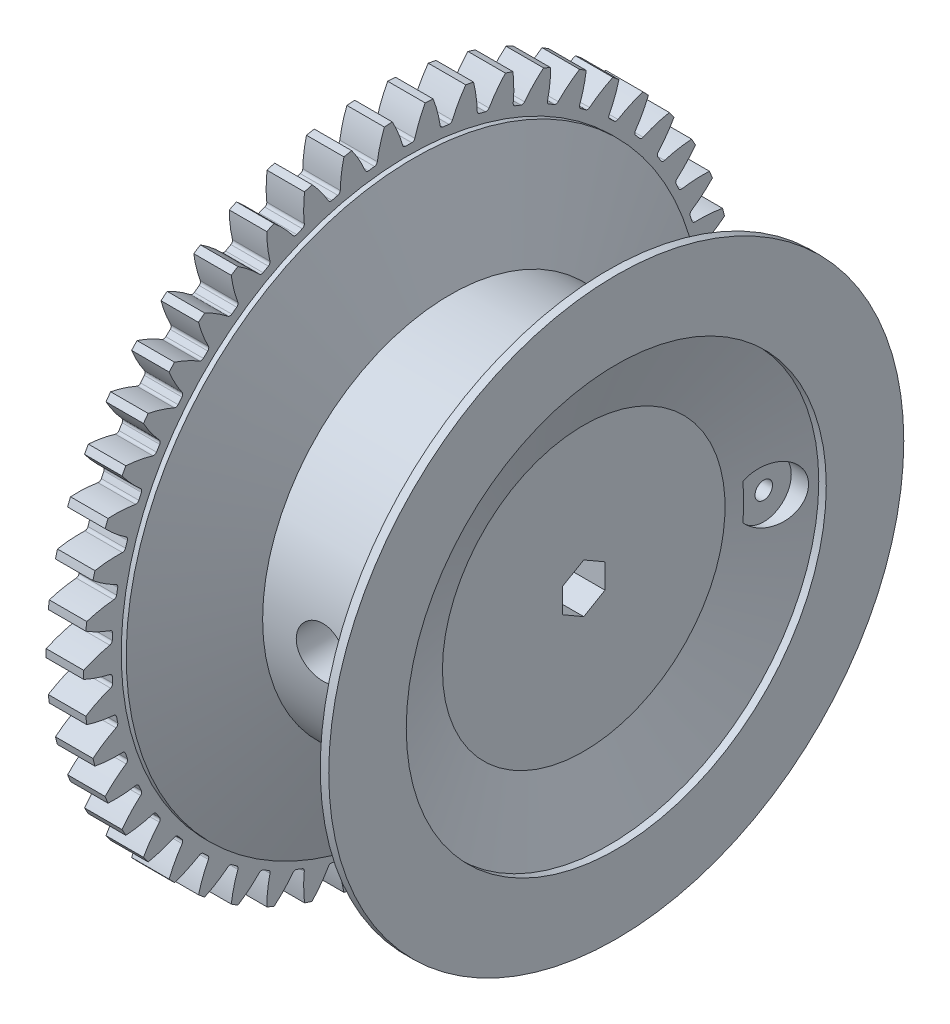
from build123d import *

# Parameters (mm, degrees)
BASPROSKE_W                = 1.5
BASPROSKE_H                = 13
TOOTHCUT_DEPTH             = 19.445866746
ROOTFILLETS_R              = 0.126
TEETHCUTS_COUNT            = 50
TEETHCUTS_ANGLE            = 352.8
ROOTFILLETS_OF_TEETHCUTS_R = 0.126
SHAFTHOLE_DEPTH            = 21.683738738
SHAFTHOLE_DEPTH_BACK       = 21.683738738
PADSKE_R                   = 2
PAD_DEPTH                  = 1.5
SCREWHOLE_DEPTH            = 21.683738784
SCREWHOLE_DEPTH_BACK       = 21.683738784
SCREWHOLESKE_R             = 0.35
PAD2SKE_R                  = 1.1
PAD2_DEPTH                 = 0.8
BOLD_ANGLE                 = 330
SCREWHOLE2SKE_R            = 1
SCREWHOLE2_DEPTH           = 21.683738784
WIDENSKE_W                 = 0.3
WIDENSKE_H                 = 3.100131381
CHAMFER_2_SIZE             = 0.8
CHAMFER_2_SIZE2            = 0.160409315


with BuildPart() as part:
    # BasProSke → Base-Revolve (revolve)
    with BuildSketch(Plane(origin=(0, 0, 0), x_dir=(1, 0, 0), z_dir=(0, 1, 0))):
        with Locations((0.75, 6.5)):
            Rectangle(BASPROSKE_W, BASPROSKE_H)
    revolve(axis=Axis((-10, 0, 0), (1, 0, 0)))

    # TooCutSke → ToothCut (cut, through all)
    with BuildSketch(Plane(origin=(0, 0, 0), x_dir=(0, 0, -1), z_dir=(1, 0, 0))):
        with BuildLine():
            ThreePointArc((0.218701072, 11.871985758), (0, 11.874), (-0.218701072, 11.871985758))
            ThreePointArc((-0.218701072, 11.871985758), (-0.410224227, 12.453928998), (-0.671481128, 13.008080498))
            ThreePointArc((-0.671481128, 13.008080498), (0, 13.0254), (0.671481128, 13.008080498))
            ThreePointArc((0.671481128, 13.008080498), (0.410224227, 12.453928998), (0.218701072, 11.871985758))
        make_face()
    toothcut = extrude(amount=TOOTHCUT_DEPTH, mode=Mode.SUBTRACT)

    # RootFillets
    rootfillets_edges = [part.edges().sort_by_distance(p)[0] for p in [
        (0.75, 11.871985758, -0.218701072),
        (0.75, 11.871985758, 0.218701072),
    ]]
    fillet(rootfillets_edges, radius=ROOTFILLETS_R)

    # TeethCuts: ToothCut ×50 about axis
    teethcuts_axis = Axis((-10, 0, 0), (1, 0, 0))
    for i in range(1, TEETHCUTS_COUNT):
        add(toothcut.rotate(teethcuts_axis, i * TEETHCUTS_ANGLE / (TEETHCUTS_COUNT - 1)), mode=Mode.SUBTRACT)

    # RootFillets of TeethCuts
    rootfillets_of_teethcuts_edges = [part.edges().sort_by_distance(p)[0] for p in [
        (0.75, 11.805782117, 1.270977815),
        (0.75, 11.750961092, 1.704930912),
        (0.75, 11.553394239, 2.740612623),
        (0.75, 11.44461675, 3.164272974),
        (0.75, 11.118802433, 4.167026333),
        (0.75, 10.957783965, 4.573712561),
        (0.75, 10.50886047, 5.527723548),
        (0.75, 10.29814038, 5.911021968),
        (0.75, 9.7331875, 6.80124526),
        (0.75, 9.476088971, 7.155111028),
        (0.75, 8.804016349, 7.967507272),
        (0.75, 8.504593977, 8.286359712),
        (0.75, 7.7360006, 9.008116935),
        (0.75, 7.398976456, 9.286927554),
        (0.75, 6.545983501, 9.906663212),
        (0.75, 6.176672657, 10.141035001),
        (0.75, 5.252732332, 10.648975493),
        (0.75, 4.856959039, 10.835212268),
        (0.75, 3.876642436, 11.223347069),
        (0.75, 3.460648277, 11.358511764),
        (0.75, 2.439415573, 11.620719757),
        (0.75, 2.009761024, 11.702680745),
        (0.75, 0.963717669, 11.834826752),
        (0.75, 0.527178638, 11.86229146),
        (0.75, -0.527178638, 11.86229146),
        (0.75, -0.963717669, 11.834826752),
        (0.75, -2.009761024, 11.702680745),
        (0.75, -2.439415573, 11.620719757),
        (0.75, -3.460648277, 11.358511764),
        (0.75, -3.876642436, 11.223347069),
        (0.75, -4.856959039, 10.835212268),
        (0.75, -5.252732332, 10.648975493),
        (0.75, -6.176672657, 10.141035001),
        (0.75, -6.545983501, 9.906663212),
        (0.75, -7.398976456, 9.286927554),
        (0.75, -7.7360006, 9.008116935),
        (0.75, -8.504593977, 8.286359712),
        (0.75, -8.804016349, 7.967507272),
        (0.75, -9.476088971, 7.155111028),
        (0.75, -9.7331875, 6.80124526),
        (0.75, -10.29814038, 5.911021968),
        (0.75, -10.50886047, 5.527723548),
        (0.75, -10.957783965, 4.573712561),
        (0.75, -11.118802433, 4.167026333),
        (0.75, -11.44461675, 3.164272974),
        (0.75, -11.553394239, 2.740612623),
        (0.75, -11.750961092, 1.704930912),
        (0.75, -11.805782117, 1.270977815),
        (0.75, -11.871985758, 0.218701072),
        (0.75, -11.871985758, -0.218701072),
        (0.75, -11.805782117, -1.270977815),
        (0.75, -11.750961092, -1.704930912),
        (0.75, -11.553394239, -2.740612623),
        (0.75, -11.44461675, -3.164272974),
        (0.75, -11.118802433, -4.167026333),
        (0.75, -10.957783965, -4.573712561),
        (0.75, -10.50886047, -5.527723548),
        (0.75, -10.29814038, -5.911021968),
        (0.75, -9.7331875, -6.80124526),
        (0.75, -9.476088971, -7.155111028),
        (0.75, -8.804016349, -7.967507272),
        (0.75, -8.504593977, -8.286359712),
        (0.75, -7.7360006, -9.008116935),
        (0.75, -7.398976456, -9.286927554),
        (0.75, -6.545983501, -9.906663212),
        (0.75, -6.176672657, -10.141035001),
        (0.75, -5.252732332, -10.648975493),
        (0.75, -4.856959039, -10.835212268),
        (0.75, -3.876642436, -11.223347069),
        (0.75, -3.460648277, -11.358511764),
        (0.75, -2.439415573, -11.620719757),
        (0.75, -2.009761024, -11.702680745),
        (0.75, -0.963717669, -11.834826752),
        (0.75, -0.527178638, -11.86229146),
        (0.75, 0.527178638, -11.86229146),
        (0.75, 0.963717669, -11.834826752),
        (0.75, 2.009761024, -11.702680745),
        (0.75, 2.439415573, -11.620719757),
        (0.75, 3.460648277, -11.358511764),
        (0.75, 3.876642436, -11.223347069),
        (0.75, 4.856959039, -10.835212268),
        (0.75, 5.252732332, -10.648975493),
        (0.75, 6.176672657, -10.141035001),
        (0.75, 6.545983501, -9.906663212),
        (0.75, 7.398976456, -9.286927554),
        (0.75, 7.7360006, -9.008116935),
        (0.75, 8.504593977, -8.286359712),
        (0.75, 8.804016349, -7.967507272),
        (0.75, 9.476088971, -7.155111028),
        (0.75, 9.7331875, -6.80124526),
        (0.75, 10.29814038, -5.911021968),
        (0.75, 10.50886047, -5.527723548),
        (0.75, 10.957783965, -4.573712561),
        (0.75, 11.118802433, -4.167026333),
        (0.75, 11.44461675, -3.164272974),
        (0.75, 11.553394239, -2.740612623),
        (0.75, 11.750961092, -1.704930912),
        (0.75, 11.805782117, -1.270977815),
    ]]
    fillet(rootfillets_of_teethcuts_edges, radius=ROOTFILLETS_OF_TEETHCUTS_R)

    # ReelSke → Reel (revolve)
    with BuildSketch(Plane(origin=(0, 0, 0), x_dir=(1, 0, 0), z_dir=(0, 1, 0))):
        Polygon((1.5, 11.5), (1.7, 11.5), (3.701836288, 6), (7.298163712, 6), (9.3, 11.5), (9.5, 11.5), (9.5, 0), (1.5, 0), align=None)
    revolve(axis=Axis((9.5, 0, 0), (-1, 0, 0)))

    # ShaftHoleSke → ShaftHole (cut, two sides: drawn at the far end of the back side and taken through both)
    with BuildSketch(Plane.ZY.offset(-SHAFTHOLE_DEPTH_BACK)):
        Polygon((0.85, 0.490747729), (0, 0.981495458), (-0.85, 0.490747729), (-0.85, -0.490747729), (0, -0.981495458), (0.85, -0.490747729), align=None)
    extrude(amount=SHAFTHOLE_DEPTH + SHAFTHOLE_DEPTH_BACK, mode=Mode.SUBTRACT)

    # CutSke → Cut (revolve, cut)
    with BuildSketch(Plane(origin=(0, 0, 0), x_dir=(1, 0, 0), z_dir=(0, 1, 0))):
        Polygon((0, 8.399868619), (1.5, 8.399868619), (2.5, 5.6523912), (2.5, 0), (0, 0), align=None)
        Polygon((9.5, 8.399868619), (8.5, 5.6523912), (8.5, 0), (9.5, 0), align=None)
    revolve(axis=Axis((0, 0, 0), (1, 0, 0)), mode=Mode.SUBTRACT)

    # PadSke → Pad (add)
    with BuildSketch(Plane.ZY.offset(-2.5)):
        Circle(PADSKE_R)
        Polygon((-0.85, 0.490747729), (-0.85, -0.490747729), (0, -0.981495458), (0.85, -0.490747729), (0.85, 0.490747729), (0, 0.981495458), align=None, mode=Mode.SUBTRACT)
    extrude(amount=PAD_DEPTH)

    # ScrewHoleSke → ScrewHole (cut, two sides: drawn at the far end of the back side and taken through both)
    with BuildSketch(Plane(origin=(9.5, 0, 0), x_dir=(0, 0, -1), z_dir=(1, 0, 0)).offset(-SCREWHOLE_DEPTH_BACK)):
        with Locations((7, 0)):
            Circle(SCREWHOLESKE_R)
    extrude(amount=SCREWHOLE_DEPTH + SCREWHOLE_DEPTH_BACK, mode=Mode.SUBTRACT)

    # Pad2Ske → Pad2 (cut)
    with BuildSketch(Plane(origin=(9.5, 0, 0), x_dir=(0, 0, -1), z_dir=(1, 0, 0))):
        with Locations((7, 0)):
            Circle(PAD2SKE_R)
    pad2 = extrude(amount=-PAD2_DEPTH, mode=Mode.SUBTRACT)

    # Pad3: Pad2 across plane
    add(pad2.mirror(Plane(origin=(5.5, 0, 0), x_dir=(0, 0, 1), z_dir=(1, 0, 0))), mode=Mode.SUBTRACT)

    # BoldSke → Bold (revolve, symmetric)
    with BuildSketch(Plane(origin=(0, 0, 0), x_dir=(1, 0, 0), z_dir=(0, 1, 0))) as bold_sk:
        Polygon((3.701836288, -6), (7.298163712, -6), (7.844119063, -7.5), (3.155880937, -7.5), align=None)
    revolve(axis=Axis((0, 0, 0), (1, 0, 0)), revolution_arc=BOLD_ANGLE / 2)
    revolve(bold_sk.sketch, axis=Axis((0, 0, 0), (-1, 0, 0)), revolution_arc=BOLD_ANGLE / 2)

    # ScrewHole2Ske → ScrewHole2 (cut, through all)
    with BuildSketch(Plane.XY):
        with Locations((5.5, 0)):
            Circle(SCREWHOLE2SKE_R)
    extrude(amount=SCREWHOLE2_DEPTH, mode=Mode.SUBTRACT)

    # WidenSke → Widen (revolve)
    with BuildSketch(Plane(origin=(0, 0, 0), x_dir=(1, 0, 0), z_dir=(0, 1, 0))):
        with Locations((9.65, 9.94993431)):
            Rectangle(WIDENSKE_W, WIDENSKE_H)
    revolve(axis=Axis((-10, 0, 0), (1, 0, 0)))

    # Chamfer 2
    chamfer_2_edges = [part.edges().sort_by_distance(p)[0] for p in [
        (9.3, 0, 11.5),
    ]]
    chamfer_2_side = [part.faces().sort_by_distance(p)[0] for p in [
        (8.299081856, 0, 8.75),
    ]]
    chamfer(chamfer_2_edges, length=CHAMFER_2_SIZE, length2=CHAMFER_2_SIZE2, reference=chamfer_2_side[0])


solid = part.part
